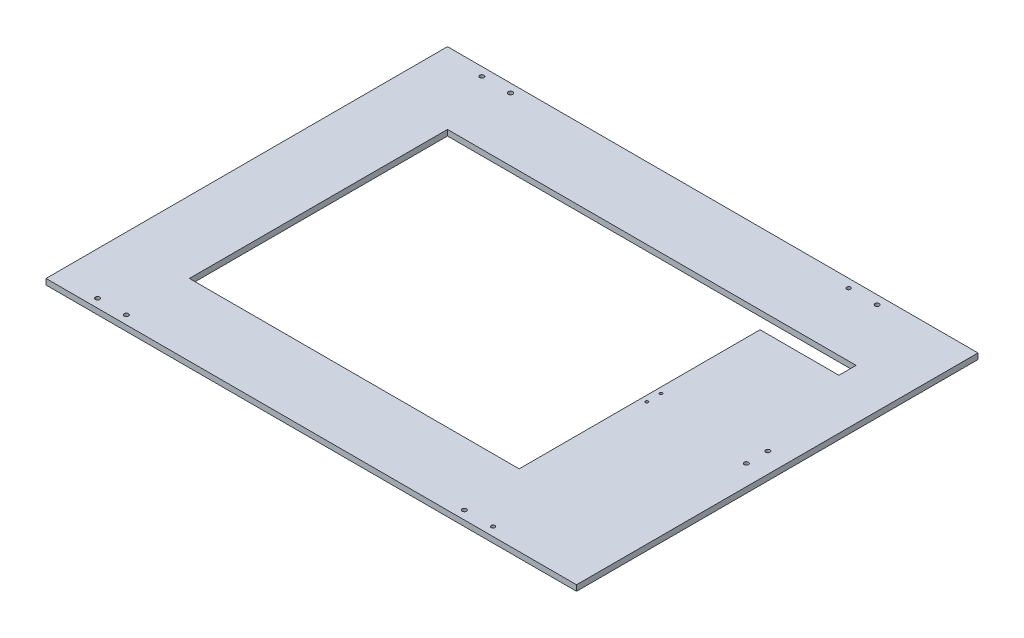
from build123d import *

# Parameters (mm, degrees)
SKETCH1_W           = 370
SKETCH1_H           = 280
SKETCH1_R           = 1.5
SKETCH1_R_2         = 1.569181713
SKETCH1_R_3         = 1.357318829
SKETCH1_R_4         = 1.322467774
SKETCH1_R_5         = 1
SKETCH1_W_2         = 230
SKETCH1_H_2         = 180
BOSS_EXTRUDE1_DEPTH = 4
SKETCH2_W           = 55
SKETCH2_H           = 12
CUT_EXTRUDE1_DEPTH  = 10
SKETCH3_R           = 1.5
CUT_EXTRUDE2_DEPTH  = 10


with BuildPart() as part:
    # Sketch1 → Boss-Extrude1 (new body)
    with BuildSketch(Plane(origin=(0, 0, 0), x_dir=(1, 0, 0), z_dir=(0, 1, 0))):
        with Locations((185, 140)):
            Rectangle(SKETCH1_W, SKETCH1_H)
        with Locations((30, 274)):
            Circle(SKETCH1_R, mode=Mode.SUBTRACT)
        with Locations((50, 274)):
            Circle(SKETCH1_R_2, mode=Mode.SUBTRACT)
        with Locations((30, 6)):
            Circle(SKETCH1_R, mode=Mode.SUBTRACT)
        with Locations((50, 6)):
            Circle(SKETCH1_R, mode=Mode.SUBTRACT)
        with Locations((285.756924446, 273.985388104)):
            Circle(SKETCH1_R_3, mode=Mode.SUBTRACT)
        with Locations((305.756860025, 273.934625414)):
            Circle(SKETCH1_R, mode=Mode.SUBTRACT)
        with Locations((285.756860726, 6.001523901)):
            Circle(SKETCH1_R, mode=Mode.SUBTRACT)
        with Locations((305.756860025, 6.006818111)):
            Circle(SKETCH1_R_4, mode=Mode.SUBTRACT)
        with Locations((284, 145)):
            Circle(SKETCH1_R_5, mode=Mode.SUBTRACT)
        with Locations((284, 135)):
            Circle(SKETCH1_R_5, mode=Mode.SUBTRACT)
        with Locations((165, 140)):
            Rectangle(SKETCH1_W_2, SKETCH1_H_2, mode=Mode.SUBTRACT)
    extrude(amount=BOSS_EXTRUDE1_DEPTH)

    # Sketch2 → Cut-Extrude1 (cut)
    with BuildSketch(Plane(origin=(0, 4, 0), x_dir=(1, 0, 0), z_dir=(0, 1, 0))):
        with Locations((307.5, 224)):
            Rectangle(SKETCH2_W, SKETCH2_H)
    extrude(amount=-CUT_EXTRUDE1_DEPTH, mode=Mode.SUBTRACT)

    # Sketch3 → Cut-Extrude2 (cut)
    with BuildSketch(Plane(origin=(0, 4, 0), x_dir=(1, 0, 0), z_dir=(0, 1, 0))):
        with Locations((356, 147.5)):
            Circle(SKETCH3_R)
        with Locations((356, 132.5)):
            Circle(SKETCH3_R)
    extrude(amount=-CUT_EXTRUDE2_DEPTH, mode=Mode.SUBTRACT)


solid = part.part
